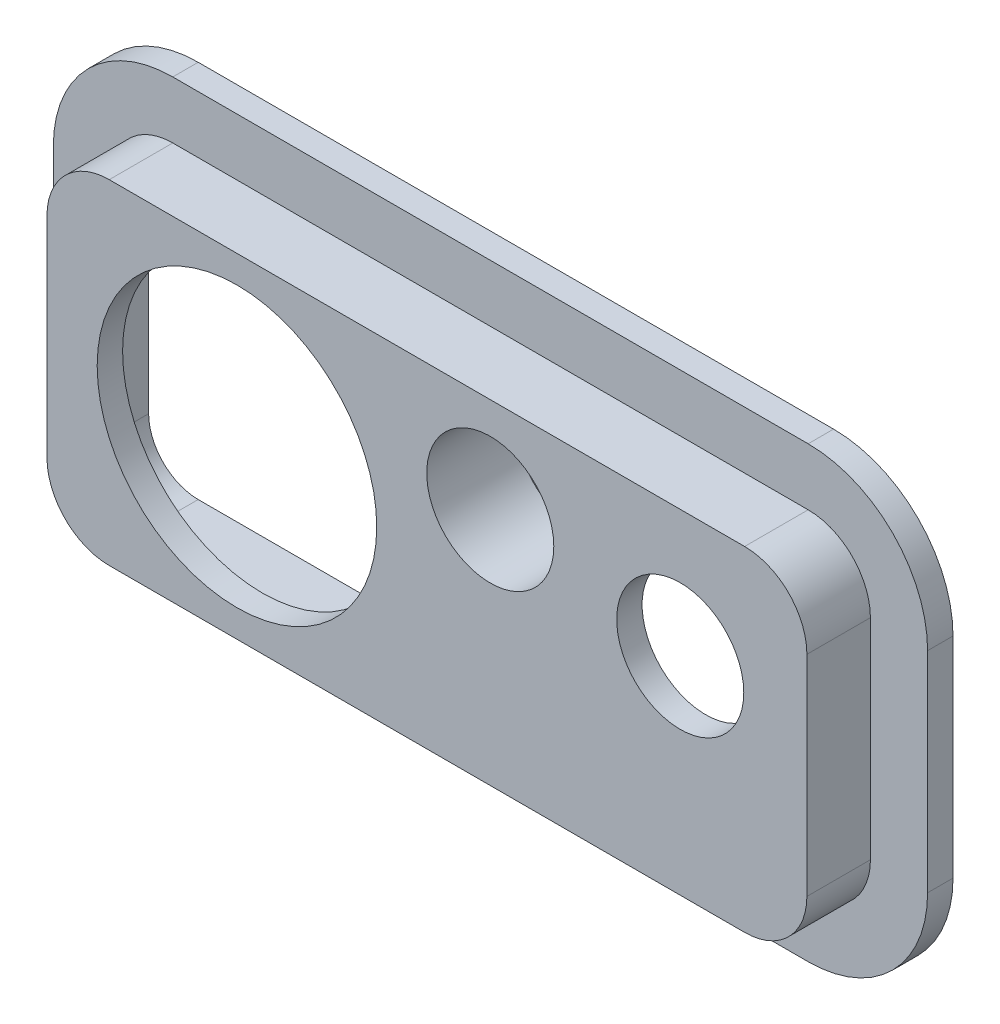
from build123d import *

# Parameters (mm, degrees)
BOSS_EXTRUDE1_DEPTH = 5
BOSS_EXTRUDE3_DEPTH = 2
CUT_EXTRUDE1_START  = -3
CUT_EXTRUDE1_DEPTH  = 3
SKETCH4_R           = 5
SKETCH4_R_2         = 11
CUT_EXTRUDE2_DEPTH  = 44.984201709
SKETCH5_R           = 7
SKETCH5_R_2         = 5
BOSS_EXTRUDE4_DEPTH = 5
FILLET1_SIZE        = 1
FILLET1_SIZE_2      = 3


with BuildPart() as part:
    # Sketch1 → Boss-Extrude1 (new body)
    with BuildSketch(Plane.XY):
        with BuildLine():
            Line((-29.9, 17.1), (-29.9, 0.6))
            ThreePointArc((-29.9, 0.6), (-28.464823228, -2.864823228), (-25, -4.3))
            Line((-25, -4.3), (25, -4.3))
            ThreePointArc((25, -4.3), (28.464823228, -2.864823228), (29.9, 0.6))
            Line((29.9, 0.6), (29.9, 17.1))
            ThreePointArc((29.9, 17.1), (28.464823228, 20.564823228), (25, 22))
            Line((25, 22), (-25, 22))
            ThreePointArc((-25, 22), (-28.464823228, 20.564823228), (-29.9, 17.1))
        make_face()
    extrude(amount=-BOSS_EXTRUDE1_DEPTH)

    # Sketch2 → Boss-Extrude3 (add)
    with BuildSketch(Plane(origin=(0, 0, -5), x_dir=(-1, 0, 0), z_dir=(0, 0, -1))):
        with BuildLine():
            Line((34.4, 0.6), (34.4, 17.1))
            ThreePointArc((34.4, 17.1), (31.646803743, 23.746803743), (25, 26.5))
            Line((25, 26.5), (-25, 26.5))
            ThreePointArc((-25, 26.5), (-31.646803743, 23.746803743), (-34.4, 17.1))
            Line((-34.4, 17.1), (-34.4, 0.6))
            ThreePointArc((-34.4, 0.6), (-31.646803743, -6.046803743), (-25, -8.8))
            Line((-25, -8.8), (25, -8.8))
            ThreePointArc((25, -8.8), (31.646803743, -6.046803743), (34.4, 0.6))
        make_face()
        with BuildLine():
            Line((28.9, 0.6), (28.9, 17.1))
            ThreePointArc((28.9, 17.1), (27.757716447, 19.857716447), (25, 21))
            Line((25, 21), (-25, 21))
            ThreePointArc((-25, 21), (-27.757716447, 19.857716447), (-28.9, 17.1))
            Line((-28.9, 17.1), (-28.9, 0.6))
            ThreePointArc((-28.9, 0.6), (-27.757716447, -2.157716447), (-25, -3.3))
            Line((-25, -3.3), (25, -3.3))
            ThreePointArc((25, -3.3), (27.757716447, -2.157716447), (28.9, 0.6))
        make_face(mode=Mode.SUBTRACT)
    extrude(amount=BOSS_EXTRUDE3_DEPTH)

    # Sketch3 → Cut-Extrude1 (cut)
    with BuildSketch(Plane(origin=(0, 0, -5), x_dir=(-1, 0, 0), z_dir=(0, 0, -1)).offset(CUT_EXTRUDE1_START)):
        with BuildLine():
            Line((-25, -3.3), (25, -3.3))
            ThreePointArc((25, -3.3), (27.757716447, -2.157716447), (28.9, 0.6))
            Line((28.9, 0.6), (28.9, 17.1))
            ThreePointArc((28.9, 17.1), (27.757716447, 19.857716447), (25, 21))
            Line((25, 21), (-25, 21))
            ThreePointArc((-25, 21), (-27.757716447, 19.857716447), (-28.9, 17.1))
            Line((-28.9, 17.1), (-28.9, 0.6))
            ThreePointArc((-28.9, 0.6), (-27.757716447, -2.157716447), (-25, -3.3))
        make_face()
    extrude(amount=CUT_EXTRUDE1_DEPTH, mode=Mode.SUBTRACT)

    # Sketch4 → Cut-Extrude2 (cut, through all)
    with BuildSketch(Plane.XY):
        with Locations((4.983333333, 14.5)):
            Circle(SKETCH4_R)
        with Locations((-14.95, 8.85)):
            Circle(SKETCH4_R_2)
        with Locations((19.933333333, 12)):
            Circle(SKETCH4_R)
    extrude(amount=-CUT_EXTRUDE2_DEPTH, mode=Mode.SUBTRACT)

    # Sketch5 → Boss-Extrude4 (add)
    with BuildSketch(Plane(origin=(0, 0, -2), x_dir=(-1, 0, 0), z_dir=(0, 0, -1))):
        with Locations((-4.983333333, 14.5)):
            Circle(SKETCH5_R)
        with Locations(Location((-4.983333333, 14.5, 0), (0, 0, 180))):
            Circle(SKETCH5_R_2, mode=Mode.SUBTRACT)
    extrude(amount=BOSS_EXTRUDE4_DEPTH)

    # Fillet1
    # an asymmetric fillet: 3, 1 mm, written as the material it adds along each edge
    with BuildSketch(Plane(origin=(4.983333333, 14.5, -2), x_dir=(-0.6399684103972102, 0.7684012192166719, 0), z_dir=(-0.7684012192166719, -0.6399684103972102, 0))) as fillet1_piece_1_section:
        with BuildLine():
            Bezier((7 + FILLET1_SIZE, 0), (7, 0), (7, FILLET1_SIZE_2), weights=[1, 0.707106781, 1])
            Line((7, FILLET1_SIZE_2), (7, 0))
            Line((7, 0), (7 + FILLET1_SIZE, 0))
        make_face()
    fillet1_piece_1 = revolve(axis=Axis((4.983333333, 14.5, -2), (0, 0, -1)), revolution_arc=309.789463983, mode=Mode.PRIVATE)
    fillet1_piece_1 = split(fillet1_piece_1, bisect_by=Plane(origin=(1.135555839, 21, -2.732538618), z_dir=(0, -1, 0)), keep=Keep.TOP, mode=Mode.PRIVATE)
    add(fillet1_piece_1)
    with BuildSketch(Plane(origin=(4.983333333, 14.5, -2), x_dir=(-1, 0, 0), z_dir=(0, -1, 0))) as fillet1_piece_2_section:
        with BuildLine():
            Bezier((7 + FILLET1_SIZE, 0), (7, 0), (7, FILLET1_SIZE_2), weights=[1, 0.707106781, 1])
            Line((7, FILLET1_SIZE_2), (7, 0))
            Line((7, 0), (7 + FILLET1_SIZE, 0))
        make_face()
    fillet1_piece_2 = revolve(axis=Axis((4.983333333, 14.5, -2), (0, 0, -1)), revolution_arc=129.61571024, mode=Mode.PRIVATE)
    fillet1_piece_2 = split(fillet1_piece_2, bisect_by=Plane(origin=(-1.041526042, 21, -2.873194596), z_dir=(0, -1, 0)), keep=Keep.TOP, mode=Mode.PRIVATE)
    add(fillet1_piece_2)


solid = part.part
